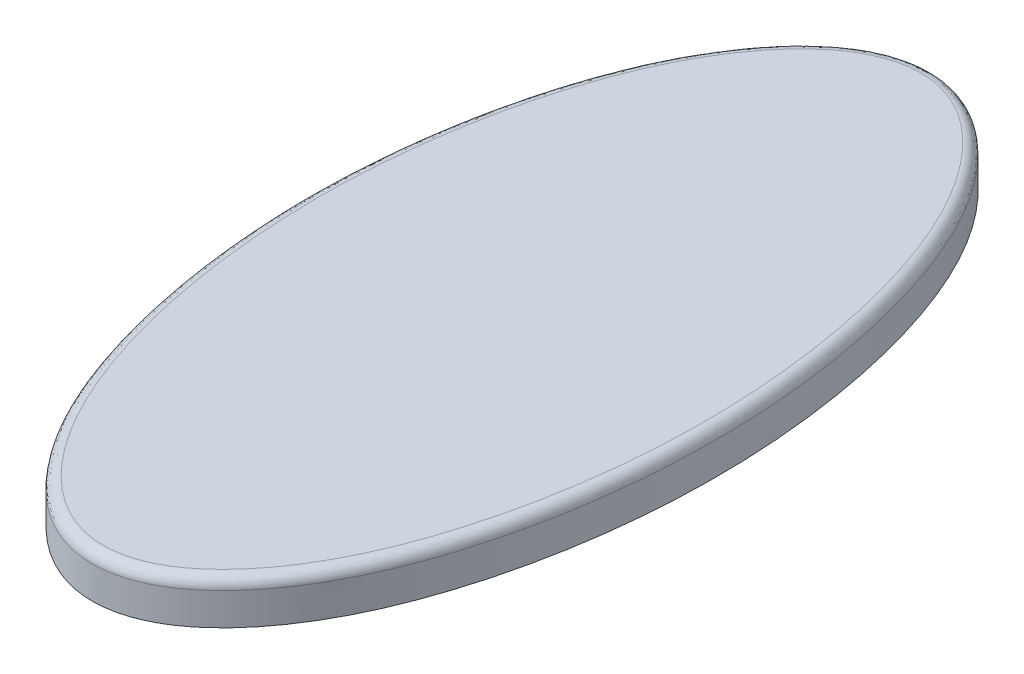
from build123d import *

# Parameters (mm, degrees)
BOSS_EXTRUDE1_DEPTH = 0.508
FILLET1_R           = 0.127


# Read off the part's stored shape, not the designer's step: Boss-Extrude1
with BuildPart() as part:
    # Boss-Extrude1 outline → Boss-Extrude1 (new body)
    with BuildSketch(Plane(origin=(0, 0, 0), x_dir=(1, 0, 0), z_dir=(0, 1, 0))):
        with BuildLine():
            add(Edge.make_bspline(
                [(0, 4.953), (-0.30145671, 4.953), (-0.90437013, 4.717325166), (-2.00320407, 3.271441), (-2.686197287, 0), (-2.00320407, -3.271441), (-0.90437013, -4.717325166), (0, -5.070837417), (0.90437013, -4.717325166), (2.00320407, -3.271441), (2.686197287, 0), (2.00320407, 3.271441), (0.90437013, 4.717325166), (0.30145671, 4.953), (0, 4.953)],
                knots=[0, 0, 0, 0, 0.392699082, 0.785398163, 1.570796327, 2.35619449, 2.748893572, 3.141592654, 3.534291735, 3.926990817, 4.71238898, 5.497787144, 5.890486225, 6.283185307, 6.283185307, 6.283185307, 6.283185307], degree=3))
        make_face()
    extrude(amount=BOSS_EXTRUDE1_DEPTH)

    # Fillet1
    fillet1_edges = [part.edges().sort_by_distance(p)[0] for p in [
        (0, 0.508, 4.953),
    ]]
    fillet(fillet1_edges, radius=FILLET1_R)


solid = part.part
